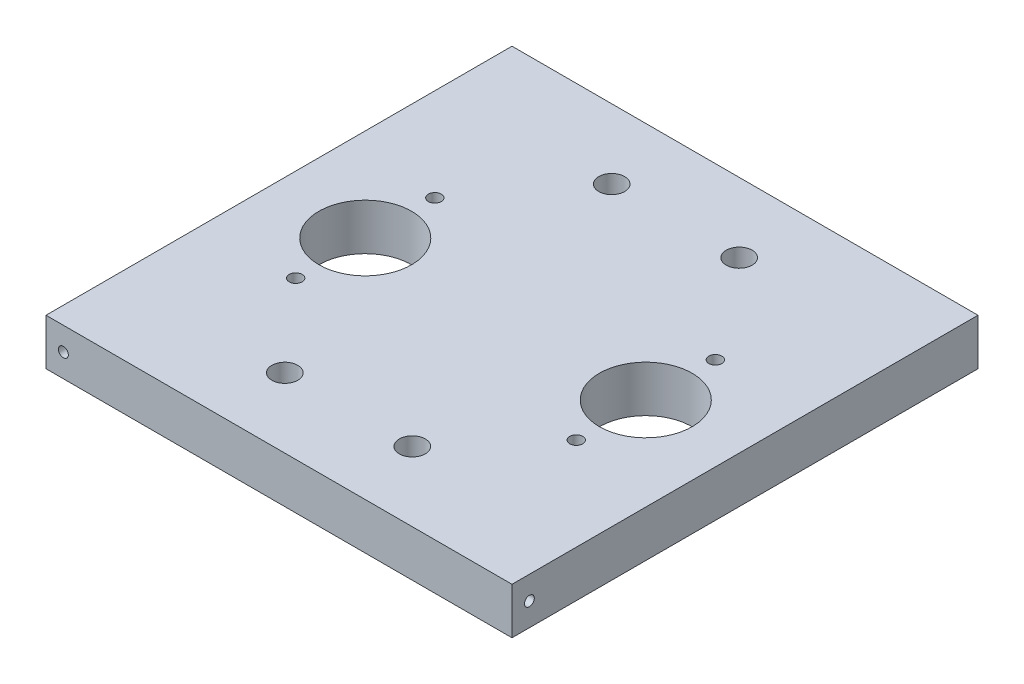
from build123d import *

# Parameters (mm, degrees)
SKETCH1_W                      = 127.635
SKETCH1_H                      = 127.635
MAIN_PLATE_DEPTH               = 12.7
SKETCH2_R                      = 3.556
U_BOLT_HOLE_DEPTH              = 12.7
U_BOLT_PATTERN_COUNT           = 2
U_BOLT_PATTERN_PITCH           = 34.925
U_BOLT_PATTERN_COUNT_DIR2      = 2
U_BOLT_PATTERN_PITCH_DIR2      = 89.535
SKETCH3_R                      = 1.778
RAPTOR_BOLT_HOLE_DEPTH         = 12.7
RAPTOR_BOLT_PATTERN_COUNT      = 2
RAPTOR_BOLT_PATTERN_PITCH      = 38.1
RAPTOR_BOLT_PATTERN_COUNT_DIR2 = 2
RAPTOR_BOLT_PATTERN_PITCH_DIR2 = 76.835
SKETCH4_R                      = 12.7
CO2_CYLINDER_HOLE_DEPTH        = 12.7
CO2_PATTERN_COUNT              = 2
CO2_PATTERN_PITCH              = 76.835
SKETCH5_R                      = 1.35255
FRAME_ATTACHMENT_HOLE_1_DEPTH  = 12.7
SKETCH6_R                      = 1.35255
FRAME_ATTACHMENT_HOLE_2_DEPTH  = 12.7
SKETCH7_R                      = 1.35255
FRAME_ATTACHMENT_HOLE_3_DEPTH  = 12.7
SKETCH8_R                      = 1.35255
FRAME_ATTACHMENT_HOLE_4_DEPTH  = 12.7


with BuildPart() as part:
    # Sketch1 → Main Plate (new body)
    with BuildSketch(Plane(origin=(0, 0, 0), x_dir=(1, 0, 0), z_dir=(0, 1, 0))):
        with Locations((63.8175, 63.8175)):
            Rectangle(SKETCH1_W, SKETCH1_H)
    extrude(amount=MAIN_PLATE_DEPTH)

    # Sketch2 → U-Bolt Hole (cut)
    with BuildSketch(Plane(origin=(0, 12.7, 0), x_dir=(1, 0, 0), z_dir=(0, 1, 0))):
        with Locations((46.355, 108.585)):
            Circle(SKETCH2_R)
    u_bolt_hole = extrude(amount=-U_BOLT_HOLE_DEPTH, mode=Mode.SUBTRACT)

    # U-Bolt Pattern: U-Bolt Hole 2 × 2
    with Locations(*[(i * U_BOLT_PATTERN_PITCH, 0, j * U_BOLT_PATTERN_PITCH_DIR2) for i in range(U_BOLT_PATTERN_COUNT) for j in range(U_BOLT_PATTERN_COUNT_DIR2) if (i, j) != (0, 0)]):
        add(u_bolt_hole, mode=Mode.SUBTRACT)

    # Sketch3 → Raptor Bolt Hole (cut)
    with BuildSketch(Plane(origin=(0, 12.7, 0), x_dir=(1, 0, 0), z_dir=(0, 1, 0))):
        with Locations((25.4, 42.9895)):
            Circle(SKETCH3_R)
    raptor_bolt_hole = extrude(amount=-RAPTOR_BOLT_HOLE_DEPTH, mode=Mode.SUBTRACT)

    # Raptor Bolt Pattern: Raptor Bolt Hole 2 × 2
    with Locations(*[(j * RAPTOR_BOLT_PATTERN_PITCH_DIR2, 0, -i * RAPTOR_BOLT_PATTERN_PITCH) for i in range(RAPTOR_BOLT_PATTERN_COUNT) for j in range(RAPTOR_BOLT_PATTERN_COUNT_DIR2) if (i, j) != (0, 0)]):
        add(raptor_bolt_hole, mode=Mode.SUBTRACT)

    # Sketch4 → Co2 Cylinder Hole (cut)
    with BuildSketch(Plane(origin=(0, 12.7, 0), x_dir=(1, 0, 0), z_dir=(0, 1, 0))):
        with Locations((25.4, 62.0395)):
            Circle(SKETCH4_R)
    co2_cylinder_hole = extrude(amount=-CO2_CYLINDER_HOLE_DEPTH, mode=Mode.SUBTRACT)

    # Co2 Pattern: Co2 Cylinder Hole ×2
    with Locations(*[(i * CO2_PATTERN_PITCH, 0, 0) for i in range(1, CO2_PATTERN_COUNT)]):
        add(co2_cylinder_hole, mode=Mode.SUBTRACT)

    # Sketch5 → Frame attachment hole 1 (cut)
    with BuildSketch(Plane.XY):
        with Locations((4.7625, 6.35)):
            Circle(SKETCH5_R)
    extrude(amount=-FRAME_ATTACHMENT_HOLE_1_DEPTH, mode=Mode.SUBTRACT)

    # Sketch6 → Frame attachment hole 2 (cut)
    with BuildSketch(Plane.ZY):
        with Locations((-122.8725, 6.35)):
            Circle(SKETCH6_R)
    extrude(amount=-FRAME_ATTACHMENT_HOLE_2_DEPTH, mode=Mode.SUBTRACT)

    # Sketch7 → Frame attachment hole 3 (cut)
    with BuildSketch(Plane(origin=(0, 0, -127.635), x_dir=(-1, 0, 0), z_dir=(0, 0, -1))):
        with Locations((-122.8725, 6.35)):
            Circle(SKETCH7_R)
    extrude(amount=-FRAME_ATTACHMENT_HOLE_3_DEPTH, mode=Mode.SUBTRACT)

    # Sketch8 → Frame attachment hole 4 (cut)
    with BuildSketch(Plane(origin=(127.635, 0, 0), x_dir=(0, 0, -1), z_dir=(1, 0, 0))):
        with Locations((4.7625, 6.35)):
            Circle(SKETCH8_R)
    extrude(amount=-FRAME_ATTACHMENT_HOLE_4_DEPTH, mode=Mode.SUBTRACT)


solid = part.part
